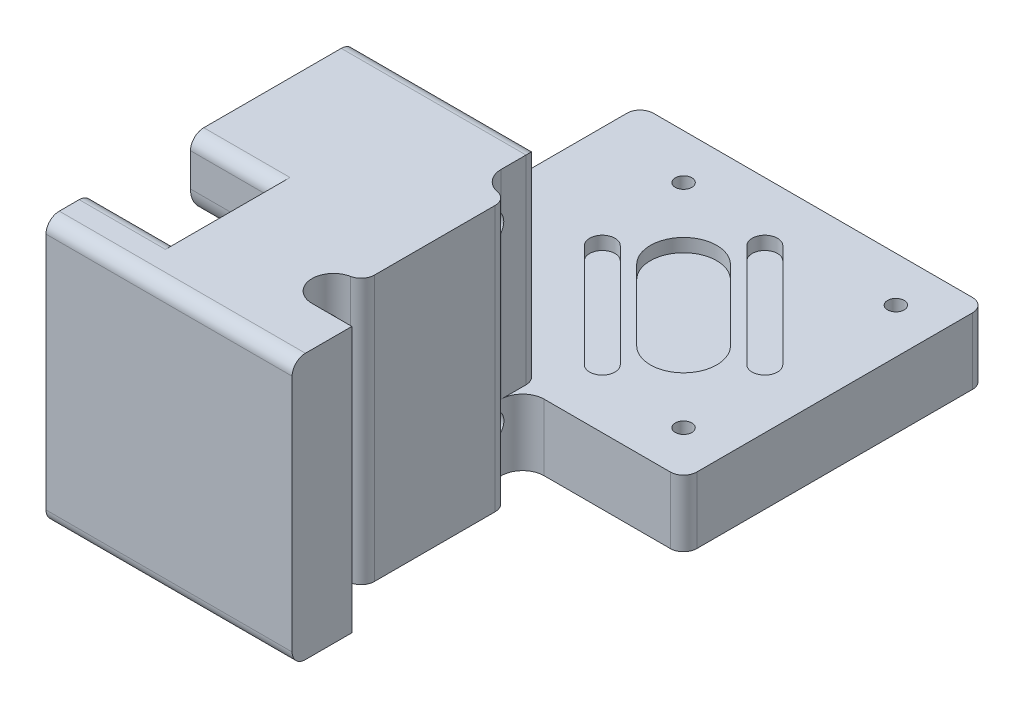
from build123d import *

# Parameters (mm, degrees)
SKETCH3_W                       = 13.49028586
SKETCH3_H                       = 10
BOSS_EXTRUDE1_DEPTH             = 22
SKETCH3_W_2                     = 3
BOSS_EXTRUDE1_2_DEPTH           = 22
BOSS_EXTRUDE1_3_DEPTH           = 22
SKETCH4_W                       = 27.150730292
SKETCH4_H                       = 10
BOSS_EXTRUDE2_DEPTH             = 3
SKETCH5_W                       = 27.150730292
SKETCH5_H                       = 10
BOSS_EXTRUDE3_DEPTH             = 3
SKETCH7_W                       = 13
SKETCH7_H                       = 14.78
BOSS_EXTRUDE4_DEPTH             = 10
BOSS_EXTRUDE5_DEPTH             = 10
SKETCH15_R                      = 1.915111108
CUT_EXTRUDE4_DEPTH              = 320.596652048
SKETCH18_W                      = 13
SKETCH18_H                      = 14.78
BOSS_EXTRUDE6_DEPTH             = 30
M4_CLEARANCE_HOLE1_D            = 4.3
CUT_EXTRUDE7_DEPTH              = 5
CUT_EXTRUDE6_DEPTH              = 2
TAP_DRILL_FOR_M3X0_5_TAP1_D     = 2.5
SKETCH43_W                      = 32.1
SKETCH43_H                      = 30
BOSS_EXTRUDE9_DEPTH             = 2.5
SKETCH27_W                      = 22.72
SKETCH27_H                      = 12
CUT_EXTRUDE9_DEPTH              = 13
FILLET1_R                       = 2
FILLET2_R                       = 4
CBORE_FOR_M4_SHCS1_D            = 4.3
CBORE_FOR_M4_SHCS1_CBORE_D      = 8
CBORE_FOR_M4_SHCS1_CBORE_DEPTH  = 5
SKETCH31_W                      = 37.1
SKETCH31_H                      = 40
BOSS_EXTRUDE8_DEPTH             = 2
TAP_DRILL_FOR_M3X0_5_TAP2_D     = 2.5
TAP_DRILL_FOR_M3X0_5_TAP2_DEPTH = 8
TAP_DRILL_FOR_M3X0_5_TAP2_TIP   = 0.751075774
FILLET4_R                       = 2
CUT_EXTRUDE10_REACH             = 325.465
CUT_EXTRUDE12_DEPTH             = 10
FILLET5_R                       = 2
M5_CLEARANCE_HOLE1_D            = 5.3
M5_CLEARANCE_HOLE1_DEPTH        = 2
BOSS_EXTRUDE10_START            = -8
BOSS_EXTRUDE10_DEPTH            = 8


with BuildPart() as part:
    # Sketch3 → Boss-Extrude1 (new body)
    with BuildSketch(Plane(origin=(-188.9, 0, 188.9), x_dir=(0.7071067811865475, 0, 0.7071067811865477), z_dir=(-0.7071067811865477, 0, 0.7071067811865475))):
        with Locations((0, -11.606969024)):
            Rectangle(SKETCH3_W, SKETCH3_H)
    extrude(amount=-BOSS_EXTRUDE1_DEPTH)



with BuildPart() as body_2:
    # Sketch3 → Boss-Extrude1 2 (new body)
    with BuildSketch(Plane(origin=(-188.9, 0, 188.9), x_dir=(0.7071067811865475, 0, 0.7071067811865477), z_dir=(-0.7071067811865477, 0, 0.7071067811865475))):
        with Locations((12.075365146, -11.606969024)):
            Rectangle(SKETCH3_W_2, SKETCH3_H)
    extrude(amount=-BOSS_EXTRUDE1_2_DEPTH)


with BuildPart() as body_3:
    # Sketch3 → Boss-Extrude1 3 (new body)
    with BuildSketch(Plane(origin=(-188.9, 0, 188.9), x_dir=(0.7071067811865475, 0, 0.7071067811865477), z_dir=(-0.7071067811865477, 0, 0.7071067811865475))):
        with Locations((-12.075365146, -11.606969024)):
            Rectangle(SKETCH3_W_2, SKETCH3_H)
    extrude(amount=-BOSS_EXTRUDE1_3_DEPTH)


with BuildPart() as part_1:
    add(part.part)

    add(body_2.part)  # Boss-Extrude2 merges body 2

    add(body_3.part)  # Boss-Extrude2 merges body 3
    # Sketch4 → Boss-Extrude2 (add)
    with BuildSketch(Plane(origin=(-188.9, 0, 188.9), x_dir=(0.7071067811865472, 0, 0.7071067811865479), z_dir=(-0.7071067811865479, 0, 0.7071067811865472))):
        with Locations((0, -11.606969024)):
            Rectangle(SKETCH4_W, SKETCH4_H)
    extrude(amount=BOSS_EXTRUDE2_DEPTH)

    # Sketch5 → Boss-Extrude3 (add)
    with BuildSketch(Plane(origin=(-173.343650814, 0, 173.343650814), x_dir=(-0.7071067811865472, 0, -0.7071067811865479), z_dir=(0.7071067811865479, 0, -0.7071067811865472))):
        with Locations((0, -11.606969024)):
            Rectangle(SKETCH5_W, SKETCH5_H)
    extrude(amount=BOSS_EXTRUDE3_DEPTH)

    # Sketch7 → Boss-Extrude4 (add)
    with BuildSketch(Plane(origin=(0, -6.606969024, 0), x_dir=(1, 0, 0), z_dir=(0, 1, 0))):
        Polygon((-183.9, -238.9), (-188.9, -238.9), (-188.9, -245.9), (-146.8, -245.9), (-146.8, -161.623097719), (-180.821563222, -161.623097719), (-161.623097719, -180.821563222), (-181.422087592, -200.620553095), (-200.620553095, -181.422087592), (-200.620553095, -203.9), (-183.9, -203.9), align=None)
        with Locations((-158.3, -233.51)):
            Rectangle(SKETCH7_W, SKETCH7_H, mode=Mode.SUBTRACT)
    extrude(amount=-BOSS_EXTRUDE4_DEPTH)

    # Sketch13 → Boss-Extrude5 (add)
    with BuildSketch(Plane(origin=(0, -6.606969024, 0), x_dir=(1, 0, 0), z_dir=(0, 1, 0))):
        Polygon((-203.9, -203.9), (-200.620553095, -203.9), (-200.620553095, -181.422087592), (-180.821563222, -161.623097719), (-146.8, -161.623097719), (-146.8, -158.343650814), (-203.9, -158.343650814), align=None)
    extrude(amount=-BOSS_EXTRUDE5_DEPTH)

    # Sketch15 → Cut-Extrude4 (cut, through all)
    with BuildSketch(Plane(origin=(0, -6.606969024, 0), x_dir=(1, 0, 0), z_dir=(0, 1, 0))):
        with Locations((-179.467375171, -167.219926457)):
            Circle(SKETCH15_R)
        with Locations((-167.219926457, -179.467375171)):
            Circle(SKETCH15_R)
        with Locations((-195.023724357, -182.776275643)):
            Circle(SKETCH15_R)
        with Locations((-182.776275643, -195.023724357)):
            Circle(SKETCH15_R)
    extrude(amount=-CUT_EXTRUDE4_DEPTH, mode=Mode.SUBTRACT)

    # Sketch18 → Boss-Extrude6 (add)
    with BuildSketch(Plane(origin=(0, -6.606969024, 0), x_dir=(1, 0, 0), z_dir=(0, 1, 0))):
        Polygon((-183.9, -203.9), (-146.8, -203.9), (-146.8, -245.9), (-188.9, -245.9), (-188.9, -238.9), (-183.9, -238.9), align=None)
        with Locations((-158.3, -233.51)):
            Rectangle(SKETCH18_W, SKETCH18_H, mode=Mode.SUBTRACT)
    extrude(amount=BOSS_EXTRUDE6_DEPTH)

    # M4 Clearance Hole1 (through all)
    with Locations(Plane(origin=(-146.8, 0, 0), x_dir=(0, 0, -1), z_dir=(1, 0, 0))):
        with Locations((-208.9, 16.393030976), (-208.9, -9.606969024)):
            Hole(M4_CLEARANCE_HOLE1_D / 2)

    # Sketch22 → Cut-Extrude7 (cut)
    with BuildSketch(Plane(origin=(-146.8, 0, 0), x_dir=(0, 0, -1), z_dir=(1, 0, 0))):
        Polygon((-245.9, 23.393030976), (-245.9, -16.606969024), (-158.343650814, -16.606969024), (-158.343650814, -6.606969024), (-203.9, -6.606969024), (-203.9, 23.393030976), align=None)
    extrude(amount=-CUT_EXTRUDE7_DEPTH, mode=Mode.SUBTRACT)

    # Sketch17 → Cut-Extrude6 (cut)
    with BuildSketch(Plane(origin=(0, -6.606969024, 0), x_dir=(1, 0, 0), z_dir=(0, 1, 0))):
        with BuildLine():
            Line((-189.960660172, -182.88959236), (-179.354058454, -172.282990642))
            ThreePointArc((-179.354058454, -172.282990642), (-172.282990642, -172.282990642), (-172.282990642, -179.354058454))
            Line((-172.282990642, -179.354058454), (-182.88959236, -189.960660172))
            ThreePointArc((-182.88959236, -189.960660172), (-189.960660172, -189.960660172), (-189.960660172, -182.88959236))
        make_face()
    extrude(amount=-CUT_EXTRUDE6_DEPTH, mode=Mode.SUBTRACT)

    # Tap Drill for M3x0.5 Tap1 (through all)
    with Locations(Plane(origin=(0, -6.606969024, 0), x_dir=(1, 0, 0), z_dir=(0, 1, 0))):
        with Locations((-197.121825407, -165.121825407), (-165.121825407, -197.121825407), (-197.121825407, -197.121825407), (-165.121825407, -165.121825407)):
            Hole(TAP_DRILL_FOR_M3X0_5_TAP1_D / 2)

    # Sketch43 → Boss-Extrude9 (add)
    with BuildSketch(Plane(origin=(0, 0, 203.9), x_dir=(-1, 0, 0), z_dir=(0, 0, -1))):
        with Locations((167.85, 8.393030976)):
            Rectangle(SKETCH43_W, SKETCH43_H)
    extrude(amount=BOSS_EXTRUDE9_DEPTH)

    # Sketch27 → Cut-Extrude9 (cut)
    with BuildSketch(Plane(origin=(-151.8, 0, 0), x_dir=(0, 0, -1), z_dir=(1, 0, 0))):
        with Locations((-214.76, 6.393030976)):
            Rectangle(SKETCH27_W, SKETCH27_H)
    extrude(amount=-CUT_EXTRUDE9_DEPTH, mode=Mode.SUBTRACT)

    # Fillet1
    fillet1_edges = [part_1.edges().sort_by_distance(p)[0] for p in [
        (-158.3, 0.393030976, 203.4),
        (-158.3, 12.393030976, 203.4),
    ]]
    fillet(fillet1_edges, radius=FILLET1_R)

    # Fillet2
    fillet2_edges = [part_1.edges().sort_by_distance(p)[0] for p in [
        (-158.3, 12.393030976, 226.12),
        (-158.3, 0.393030976, 226.12),
    ]]
    fillet(fillet2_edges, radius=FILLET2_R)

    # CBORE for M4 SHCS1 (through all)
    with Locations(Plane(origin=(-164.8, 0, 0), x_dir=(0, 0, -1), z_dir=(1, 0, 0))):
        with Locations((-234.9, 16.393030976), (-234.9, -9.606969024)):
            CounterBoreHole(CBORE_FOR_M4_SHCS1_D / 2, CBORE_FOR_M4_SHCS1_CBORE_D / 2, CBORE_FOR_M4_SHCS1_CBORE_DEPTH)

    # Sketch31 → Boss-Extrude8 (add)
    with BuildSketch(Plane.XY.offset(245.9)):
        with Locations((-170.35, 3.393030976)):
            Rectangle(SKETCH31_W, SKETCH31_H)
    extrude(amount=BOSS_EXTRUDE8_DEPTH)

    # Tap Drill for M3x0.5 Tap2
    with Locations(Plane(origin=(-151.8, 0, 0), x_dir=(0, 0, -1), z_dir=(1, 0, 0))):
        with Locations((-244.4, 16.393030976), (-244.4, -9.606969024)):
            Hole(TAP_DRILL_FOR_M3X0_5_TAP2_D / 2, depth=TAP_DRILL_FOR_M3X0_5_TAP2_DEPTH)
            with Locations((0, 0, -(TAP_DRILL_FOR_M3X0_5_TAP2_DEPTH + TAP_DRILL_FOR_M3X0_5_TAP2_TIP / 2))):  # 118° drill point
                Cone(0, TAP_DRILL_FOR_M3X0_5_TAP2_D / 2, TAP_DRILL_FOR_M3X0_5_TAP2_TIP, mode=Mode.SUBTRACT)

    # Fillet4
    fillet4_edges = [part_1.edges().sort_by_distance(p)[0] for p in [
        (-158.3, -16.606969024, 226.12),
        (-203.9, -11.606969024, 203.9),
        (-203.9, -11.606969024, 158.343650814),
        (-158.3, 23.393030976, 226.12),
        (-158.3, 23.393030976, 240.9),
        (-151.8, -11.606969024, 158.343650814),
        (-167.85, 23.393030976, 201.4),
        (-170.35, -16.606969024, 247.9),
        (-170.35, 23.393030976, 247.9),
        (-158.3, -16.606969024, 240.9),
    ]]
    fillet(fillet4_edges, radius=FILLET4_R)

    # Cut-Extrude10: up to this face of the body (flat: up to its plane)
    cut_extrude10_end = Plane(part_1.part.faces().sort_by_distance((-177.85, -6.606969024, 159.03573397))[0])
    # Sketch36 → Cut-Extrude10 (cut, up to the picked face)
    with BuildSketch(Plane(origin=(0, 23.393030976, 0), x_dir=(1, 0, 0), z_dir=(0, 1, 0)), mode=Mode.PRIVATE) as cut_extrude10_sk1:
        with BuildLine():
            Line((-182.9, -232.4), (-183.9, -232.4))
            Line((-183.9, -232.4), (-183.9, -238.9))
            Line((-183.9, -238.9), (-182.9, -238.9))
            ThreePointArc((-182.9, -238.9), (-179.65, -235.65), (-182.9, -232.4))
        make_face()
    cut_extrude10_tool1 = split(extrude(cut_extrude10_sk1.sketch, amount=-CUT_EXTRUDE10_REACH, mode=Mode.PRIVATE), bisect_by=cut_extrude10_end, keep=Keep.BOTH, mode=Mode.PRIVATE)
    # Sketch36 → Cut-Extrude10 (cut, up to the picked face)
    with BuildSketch(Plane(origin=(0, 23.393030976, 0), x_dir=(1, 0, 0), z_dir=(0, 1, 0)), mode=Mode.PRIVATE) as cut_extrude10_sk2:
        with BuildLine():
            Line((-183.9, -210.4), (-183.9, -201.4))
            Line((-183.9, -201.4), (-177.65, -201.4))
            ThreePointArc((-177.65, -201.4), (-179.064213562, -201.985786438), (-179.65, -203.4))
            Line((-179.65, -203.4), (-179.65, -207.15))
            ThreePointArc((-179.65, -207.15), (-180.601902961, -209.448097039), (-182.9, -210.4))
            Line((-182.9, -210.4), (-183.9, -210.4))
        make_face()
    cut_extrude10_tool2 = split(extrude(cut_extrude10_sk2.sketch, amount=-CUT_EXTRUDE10_REACH, mode=Mode.PRIVATE), bisect_by=cut_extrude10_end, keep=Keep.BOTH, mode=Mode.PRIVATE)
    add(cut_extrude10_tool1.solids().sort_by(Axis((-182.04967, 23.393031, 235.65), (0, -1, 0)))[0], mode=Mode.SUBTRACT)
    add(cut_extrude10_tool2.solids().sort_by(Axis((-181.801157, 23.393031, 205.573356), (0, -1, 0)))[0], mode=Mode.SUBTRACT)

    # Sketch44 → Cut-Extrude12 (cut)
    with BuildSketch(Plane(origin=(0, -6.606969024, 0), x_dir=(1, 0, 0), z_dir=(0, 1, 0))):
        with BuildLine():
            Line((-183.9, -210.4), (-182.9, -210.4))
            ThreePointArc((-182.9, -210.4), (-179.65, -207.15), (-182.9, -203.9))
            Line((-182.9, -203.9), (-183.9, -203.9))
            Line((-183.9, -203.9), (-183.9, -210.4))
        make_face()
        with BuildLine():
            Line((-182.9, -232.4), (-183.9, -232.4))
            Line((-183.9, -232.4), (-183.9, -238.9))
            Line((-183.9, -238.9), (-182.9, -238.9))
            ThreePointArc((-182.9, -238.9), (-179.65, -235.65), (-182.9, -232.4))
        make_face()
    extrude(amount=-CUT_EXTRUDE12_DEPTH, mode=Mode.SUBTRACT)

    # Fillet5
    # the kernel refuses this fillet: 2 mm, written as the material it takes off along each edge
    with BuildSketch(Plane(origin=(-183.9, 34.816323168, 232.4), x_dir=(0, 0, -1), z_dir=(0, -1, 0))) as fillet5_piece_1:
        with BuildLine():
            CenterArc((1.903882032, 2), FILLET5_R, 190.980575428, 79.019424572)
            Line((-0.059501599, 1.619047619), (-0.255839962, 1.580952381))
            ThreePointArc((-0.255839962, 1.580952381), (-0.2, 1), (-0.2, 0))
            Line((-0.2, 0), (0, -0.2))
            Line((0, -0.2), (1.903882032, -0.2))
            Line((1.903882032, -0.2), (1.903882032, 0))
        make_face()
    extrude(amount=62.846584384, mode=Mode.SUBTRACT)
    with BuildSketch(Plane(origin=(-183.9, 26.276030988, 210.4), x_dir=(0.9993253657611183, 0, -0.03672619428156218), z_dir=(0, -1, 0))) as fillet5_piece_2:
        with BuildLine():
            CenterArc((1.92872839, 1.976049997), FILLET5_R, 182.104729259, 79.019424572)
            Line((-0.069922341, 1.902597608), (-0.269787415, 1.895252369))
            Line((-0.269787415, 1.895252369), (-0.199865073, -0.007345239))
            Line((-0.199865073, -0.007345239), (0.007345239, -0.199865073))
            ThreePointArc((0.007345239, -0.199865073), (1.006670605, -0.163138879), (1.589281845, -0.197605))
            Line((1.589281845, -0.197605), (1.620140621, 0))
        make_face()
    extrude(amount=45.766000024, mode=Mode.SUBTRACT)

    # M5 Clearance Hole1
    with Locations(Plane(origin=(0, 0, 201.4), x_dir=(-1, 0, 0), z_dir=(0, 0, -1))):
        with Locations((157.85, 6.393030976)):
            Hole(M5_CLEARANCE_HOLE1_D / 2, depth=M5_CLEARANCE_HOLE1_DEPTH)

    # Sketch45 → Boss-Extrude10 (add)
    with BuildSketch(Plane.XZ.offset(16.606969024).offset(BOSS_EXTRUDE10_START)):
        with BuildLine():
            Line((-165.865738406, 180.821563222), (-181.422087592, 196.377912408))
            ThreePointArc((-181.422087592, 196.377912408), (-184.130463694, 196.377912408), (-184.130463694, 193.669536306))
            Line((-184.130463694, 193.669536306), (-168.574114508, 178.11318712))
            ThreePointArc((-168.574114508, 178.11318712), (-165.865738406, 178.11318712), (-165.865738406, 180.821563222))
        make_face()
        with BuildLine():
            Line((-180.821563222, 165.865738406), (-196.377912408, 181.422087592))
            ThreePointArc((-196.377912408, 181.422087592), (-196.377912408, 184.130463694), (-193.669536306, 184.130463694))
            Line((-193.669536306, 184.130463694), (-178.11318712, 168.574114508))
            ThreePointArc((-178.11318712, 168.574114508), (-178.11318712, 165.865738406), (-180.821563222, 165.865738406))
        make_face()
    extrude(amount=BOSS_EXTRUDE10_DEPTH)


with BuildPart() as body_2_2:
    # Mirror1: mirrored copy
    add(part_1.part.mirror(Plane(origin=(-151.8, 0, 0), x_dir=(0, 0, 1), z_dir=(1, 0, 0))))


solid = body_2_2.part
